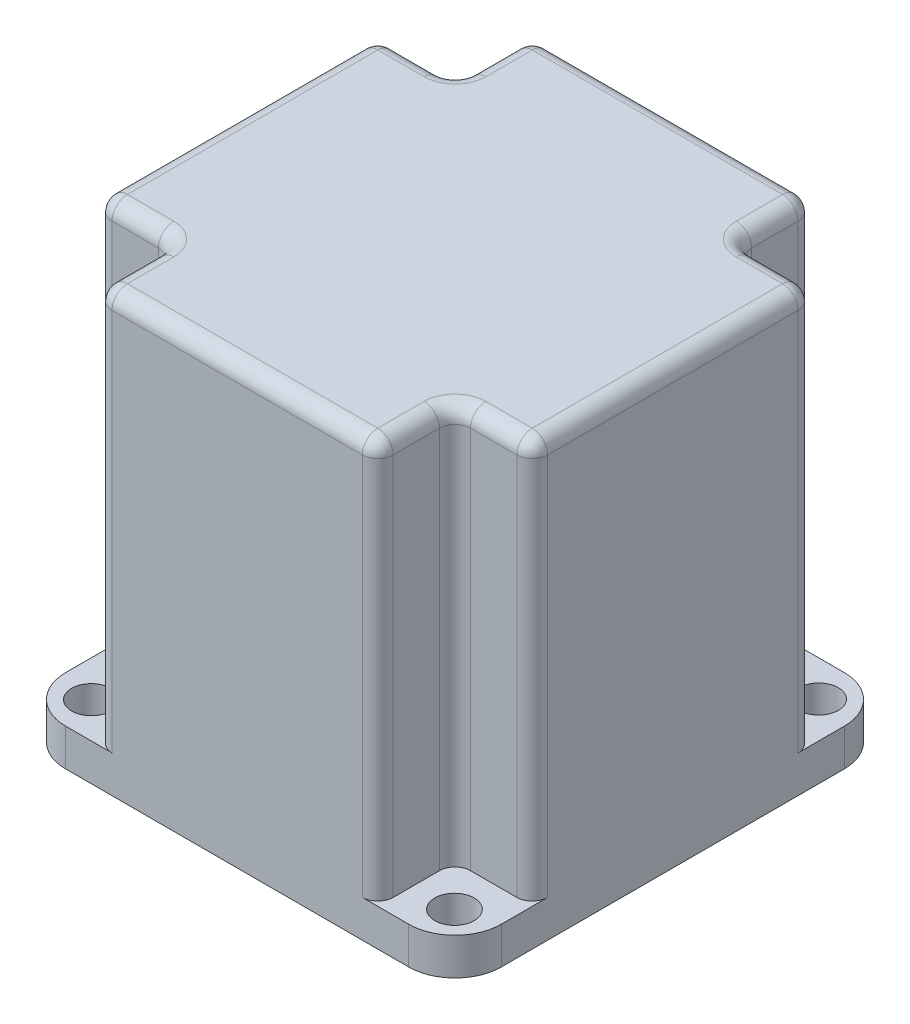
from build123d import *

# Parameters (mm, degrees)
SKETCH_1_R          = 2.55
SKETCH_1_R_2        = 19.05
EXTRUDE_1_DEPTH     = 56.4
SKETCH_1_3_R        = 19.05
SKETCH_1_3_R_2      = 4
EXTRUDE_2_DEPTH     = 1.6
SKETCH_1_4_R        = 2.55
CUT_EXTRUDE_1_DEPTH = 4.8
EXTRUDE_3_DEPTH     = 20.6
SKETCH_4_W          = 10
SKETCH_4_H          = 10
CUT_EXTRUDE_3_DEPTH = 51.6
FILLET_3_R          = 2
FILLET_4_R          = 2


with BuildPart() as part:
    # 草图1 → 凸台-拉伸1 (new body)
    # profile 1 of 10: a face of its own
    with BuildSketch(Plane(origin=(0, 0, 0), x_dir=(1, 0, 0), z_dir=(0, 1, 0))):
        with BuildLine():
            Line((-22.2, 28.2), (22.2, 28.2))
            ThreePointArc((22.2, 28.2), (26.442640687, 26.442640687), (28.2, 22.2))
            Line((28.2, 22.2), (28.2, -22.2))
            ThreePointArc((28.2, -22.2), (26.442640687, -26.442640687), (22.2, -28.2))
            Line((22.2, -28.2), (-22.2, -28.2))
            ThreePointArc((-22.2, -28.2), (-26.442640687, -26.442640687), (-28.2, -22.2))
            Line((-28.2, -22.2), (-28.2, 22.2))
            ThreePointArc((-28.2, 22.2), (-26.442640687, 26.442640687), (-22.2, 28.2))
        make_face()
        with Locations((23.5, 23.57)):
            Circle(SKETCH_1_R, mode=Mode.SUBTRACT)
        with Locations((23.5, -23.57)):
            Circle(SKETCH_1_R, mode=Mode.SUBTRACT)
        Circle(SKETCH_1_R_2, mode=Mode.SUBTRACT)
        with Locations((-23.5, 23.57)):
            Circle(SKETCH_1_R, mode=Mode.SUBTRACT)
        with Locations((-23.5, -23.57)):
            Circle(SKETCH_1_R, mode=Mode.SUBTRACT)
    # profile 2 of 10: a face of its own
    with BuildSketch(Plane(origin=(0, 0, 0), x_dir=(1, 0, 0), z_dir=(0, 1, 0))):
        Circle(SKETCH_1_R_2)
    # profile 3 of 10: a face of its own
    with BuildSketch(Plane(origin=(0, 0, 0), x_dir=(1, 0, 0), z_dir=(0, 1, 0))):
        with Locations((-23.5, 23.57)):
            Circle(SKETCH_1_R)
    # profile 4 of 10: a face of its own
    with BuildSketch(Plane(origin=(0, 0, 0), x_dir=(1, 0, 0), z_dir=(0, 1, 0))):
        with Locations((23.5, 23.57)):
            Circle(SKETCH_1_R)
    # profile 5 of 10: a face of its own
    with BuildSketch(Plane(origin=(0, 0, 0), x_dir=(1, 0, 0), z_dir=(0, 1, 0))):
        with Locations((23.5, -23.57)):
            Circle(SKETCH_1_R)
    # profile 6 of 10: a face of its own
    with BuildSketch(Plane(origin=(0, 0, 0), x_dir=(1, 0, 0), z_dir=(0, 1, 0))):
        with Locations((-23.5, -23.57)):
            Circle(SKETCH_1_R)
    # profile 7 of 10: a face of its own
    with BuildSketch(Plane(origin=(0, 0, 0), x_dir=(1, 0, 0), z_dir=(0, 1, 0))):
        with BuildLine():
            ThreePointArc((2.645751311, 3), (0, 4), (-2.645751311, 3))
            Line((-2.645751311, 3), (2.645751311, 3))
        make_face()
    # profile 8 of 10: a face of its own
    with BuildSketch(Plane(origin=(0, 0, 0), x_dir=(1, 0, 0), z_dir=(0, 1, 0))):
        with BuildLine():
            Line((2.645751311, 3), (-2.645751311, 3))
            ThreePointArc((-2.645751311, 3), (-1.645751311, -3.645751311), (4, 0))
            ThreePointArc((4, 0), (3.645751311, 1.645751311), (2.645751311, 3))
        make_face()
    # profile 9 of 10: a face of its own
    with BuildSketch(Plane(origin=(0, 0, 0), x_dir=(1, 0, 0), z_dir=(0, 1, 0))):
        with BuildLine():
            ThreePointArc((2.645751311, 3), (0, 4), (-2.645751311, 3))
            Line((-2.645751311, 3), (2.645751311, 3))
        make_face()
    # profile 10 of 10: a face of its own
    with BuildSketch(Plane(origin=(0, 0, 0), x_dir=(1, 0, 0), z_dir=(0, 1, 0))):
        with BuildLine():
            Line((2.645751311, 3), (-2.645751311, 3))
            ThreePointArc((-2.645751311, 3), (-1.645751311, -3.645751311), (4, 0))
            ThreePointArc((4, 0), (3.645751311, 1.645751311), (2.645751311, 3))
        make_face()
    extrude(amount=EXTRUDE_1_DEPTH)

    # 草图1<3> → 凸台-拉伸2 (add)
    with BuildSketch(Plane(origin=(0, 0, 0), x_dir=(1, 0, 0), z_dir=(0, 1, 0))):
        with Locations(Location((0, 0, 0), (0, 0, 270))):
            Circle(SKETCH_1_3_R)
        with Locations(Location((0, 0, 0), (0, 0, 270))):
            Circle(SKETCH_1_3_R_2, mode=Mode.SUBTRACT)
    extrude(amount=-EXTRUDE_2_DEPTH)

    # 草图1<4> → 切除-拉伸1 (cut)
    with BuildSketch(Plane(origin=(0, 0, 0), x_dir=(1, 0, 0), z_dir=(0, 1, 0))):
        with Locations(Location((23.5, -23.57, 0), (0, 0, 270))):
            Circle(SKETCH_1_4_R)
        with Locations(Location((-23.5, 23.57, 0), (0, 0, 270))):
            Circle(SKETCH_1_4_R)
        with Locations(Location((23.5, 23.57, 0), (0, 0, 270))):
            Circle(SKETCH_1_4_R)
        with Locations(Location((-23.5, -23.57, 0), (0, 0, 90))):
            Circle(SKETCH_1_4_R)
    extrude(amount=CUT_EXTRUDE_1_DEPTH, mode=Mode.SUBTRACT)

    # 草图1<5> → 凸台-拉伸3 (add)
    with BuildSketch(Plane(origin=(0, 0, 0), x_dir=(1, 0, 0), z_dir=(0, 1, 0))):
        with BuildLine():
            Line((2.645751311, 3), (-2.645751311, 3))
            ThreePointArc((-2.645751311, 3), (-1.645751311, -3.645751311), (4, 0))
            ThreePointArc((4, 0), (3.645751311, 1.645751311), (2.645751311, 3))
        make_face()
    extrude(amount=-EXTRUDE_3_DEPTH)

    # 草图4 → 切除-拉伸3 (cut)
    with BuildSketch(Plane(origin=(0, 56.4, 0), x_dir=(1, 0, 0), z_dir=(0, 1, 0))):
        with Locations((-23.2, 23.2)):
            Rectangle(SKETCH_4_W, SKETCH_4_H)
        with Locations((-23.2, -23.2)):
            Rectangle(SKETCH_4_W, SKETCH_4_H)
        with Locations((23.2, -23.2)):
            Rectangle(SKETCH_4_W, SKETCH_4_H)
        with Locations((23.2, 23.2)):
            Rectangle(SKETCH_4_W, SKETCH_4_H)
    extrude(amount=-CUT_EXTRUDE_3_DEPTH, mode=Mode.SUBTRACT)

    # 圆角3
    fillet_3_edges = [part.edges().sort_by_distance(p)[0] for p in [
        (-23.2, 56.4, -18.2),
        (-18.2, 56.4, -23.2),
        (-28.2, 30.6, -18.2),
        (-18.2, 30.6, -28.2),
        (-18.2, 30.6, -18.2),
        (28.2, 30.6, -18.2),
        (18.2, 30.6, -18.2),
        (18.2, 30.6, -28.2),
        (18.2, 56.4, -23.2),
        (23.2, 56.4, -18.2),
        (23.2, 56.4, 18.2),
        (18.2, 56.4, 23.2),
        (28.2, 30.6, 18.2),
        (18.2, 30.6, 28.2),
        (18.2, 30.6, 18.2),
        (-18.2, 56.4, 23.2),
        (-23.2, 56.4, 18.2),
        (-18.2, 30.6, 28.2),
        (-28.2, 30.6, 18.2),
        (-18.2, 30.6, 18.2),
    ]]
    fillet(fillet_3_edges, radius=FILLET_3_R)

    # 圆角4
    # the kernel refuses this fillet: 2 mm, written as the material it takes off along each edge
    with BuildSketch(Plane(origin=(26.2, 54.4, 16.2), x_dir=(0, 1, 0), z_dir=(1, 0, 0))) as fillet_4_piece_1_section:
        Polygon((0, 0), (FILLET_4_R, 0), (FILLET_4_R, FILLET_4_R), (0, FILLET_4_R), align=None)
    fillet_4_piece_1 = extrude(amount=FILLET_4_R, mode=Mode.PRIVATE)
    fillet_4_piece_1 = fillet_4_piece_1 - Plane(origin=(26.2, 54.4, 16.2), x_dir=(0, -0.7071067811865475, -0.7071067811865475), z_dir=(1, 0, 0)) * Sphere(FILLET_4_R, mode=Mode.PRIVATE)
    add(fillet_4_piece_1, mode=Mode.SUBTRACT)
    with BuildSketch(Plane(origin=(16.2, 54.4, 26.2), x_dir=(0, 1, 0), z_dir=(0, 0, 1))) as fillet_4_piece_2_section:
        Polygon((0, 0), (FILLET_4_R, 0), (FILLET_4_R, -FILLET_4_R), (0, -FILLET_4_R), align=None)
    fillet_4_piece_2 = extrude(amount=FILLET_4_R, mode=Mode.PRIVATE)
    fillet_4_piece_2 = fillet_4_piece_2 - Plane(origin=(16.2, 54.4, 26.2), x_dir=(-0.7071067811865475, -0.7071067811865475, 1.0048591735576168e-15), z_dir=(0, 0, 1)) * Sphere(FILLET_4_R, mode=Mode.PRIVATE)
    add(fillet_4_piece_2, mode=Mode.SUBTRACT)
    with BuildSketch(Plane(origin=(-26.2, 54.4, 16.2), x_dir=(0, 1, 0), z_dir=(-1, 0, 0))) as fillet_4_piece_3_section:
        Polygon((0, 0), (FILLET_4_R, 0), (FILLET_4_R, -FILLET_4_R), (0, -FILLET_4_R), align=None)
    fillet_4_piece_3 = extrude(amount=FILLET_4_R, mode=Mode.PRIVATE)
    fillet_4_piece_3 = fillet_4_piece_3 - Plane(origin=(-26.2, 54.4, 16.2), x_dir=(0, -0.7071067811865475, -0.7071067811865475), z_dir=(-1, 0, 0)) * Sphere(FILLET_4_R, mode=Mode.PRIVATE)
    add(fillet_4_piece_3, mode=Mode.SUBTRACT)
    with BuildSketch(Plane(origin=(-16.2, 54.4, 26.2), x_dir=(0, 1, 0), z_dir=(0, 0, 1))) as fillet_4_piece_4_section:
        Polygon((0, 0), (FILLET_4_R, 0), (FILLET_4_R, FILLET_4_R), (0, FILLET_4_R), align=None)
    fillet_4_piece_4 = extrude(amount=FILLET_4_R, mode=Mode.PRIVATE)
    fillet_4_piece_4 = fillet_4_piece_4 - Plane(origin=(-16.2, 54.4, 26.2), x_dir=(0.7071067811865475, -0.7071067811865475, 0), z_dir=(0, 0, 1)) * Sphere(FILLET_4_R, mode=Mode.PRIVATE)
    add(fillet_4_piece_4, mode=Mode.SUBTRACT)
    with BuildSketch(Plane(origin=(-16.2, 54.4, -26.2), x_dir=(0, 1, 0), z_dir=(0, 0, -1))) as fillet_4_piece_5_section:
        Polygon((0, 0), (FILLET_4_R, 0), (FILLET_4_R, -FILLET_4_R), (0, -FILLET_4_R), align=None)
    fillet_4_piece_5 = extrude(amount=FILLET_4_R, mode=Mode.PRIVATE)
    fillet_4_piece_5 = fillet_4_piece_5 - Plane(origin=(-16.2, 54.4, -26.2), x_dir=(0.7071067811865475, -0.7071067811865475, 0), z_dir=(0, 0, -1)) * Sphere(FILLET_4_R, mode=Mode.PRIVATE)
    add(fillet_4_piece_5, mode=Mode.SUBTRACT)
    with BuildSketch(Plane(origin=(-26.2, 54.4, -16.2), x_dir=(0, 1, 0), z_dir=(-1, 0, 0))) as fillet_4_piece_6_section:
        Polygon((0, 0), (FILLET_4_R, 0), (FILLET_4_R, FILLET_4_R), (0, FILLET_4_R), align=None)
    fillet_4_piece_6 = extrude(amount=FILLET_4_R, mode=Mode.PRIVATE)
    fillet_4_piece_6 = fillet_4_piece_6 - Plane(origin=(-26.2, 54.4, -16.2), x_dir=(0, -0.7071067811865475, 0.7071067811865475), z_dir=(-1, 0, 0)) * Sphere(FILLET_4_R, mode=Mode.PRIVATE)
    add(fillet_4_piece_6, mode=Mode.SUBTRACT)
    with BuildSketch(Plane(origin=(26.2, 54.4, -16.2), x_dir=(0, 1, 0), z_dir=(1, 0, 0))) as fillet_4_piece_7_section:
        Polygon((0, 0), (FILLET_4_R, 0), (FILLET_4_R, -FILLET_4_R), (0, -FILLET_4_R), align=None)
    fillet_4_piece_7 = extrude(amount=FILLET_4_R, mode=Mode.PRIVATE)
    fillet_4_piece_7 = fillet_4_piece_7 - Plane(origin=(26.2, 54.4, -16.2), x_dir=(0, -0.7071067811865475, 0.7071067811865475), z_dir=(1, 0, 0)) * Sphere(FILLET_4_R, mode=Mode.PRIVATE)
    add(fillet_4_piece_7, mode=Mode.SUBTRACT)
    with BuildSketch(Plane(origin=(16.2, 54.4, -26.2), x_dir=(0, 1, 0), z_dir=(0, 0, -1))) as fillet_4_piece_8_section:
        Polygon((0, 0), (FILLET_4_R, 0), (FILLET_4_R, FILLET_4_R), (0, FILLET_4_R), align=None)
    fillet_4_piece_8 = extrude(amount=FILLET_4_R, mode=Mode.PRIVATE)
    fillet_4_piece_8 = fillet_4_piece_8 - Plane(origin=(16.2, 54.4, -26.2), x_dir=(-0.7071067811865475, -0.7071067811865475, -1.0048591735576168e-15), z_dir=(0, 0, -1)) * Sphere(FILLET_4_R, mode=Mode.PRIVATE)
    add(fillet_4_piece_8, mode=Mode.SUBTRACT)
    with BuildSketch(Plane(origin=(-16.2, 56.4, -28.2), x_dir=(0, -1, 0), z_dir=(1, 0, 0)), Plane(origin=(-28.2, 56.4, 16.2), x_dir=(0, -1, 0), z_dir=(0, 0, -1)), Plane(origin=(16.2, 56.4, 28.2), x_dir=(0, -1, 0), z_dir=(-1, 0, 0)), Plane(origin=(28.2, 56.4, -16.2), x_dir=(0, -1, 0), z_dir=(0, 0, 1))) as fillet_4_piece_9:
        with BuildLine():
            CenterArc((FILLET_4_R, -FILLET_4_R), FILLET_4_R, 90, 90)
            Line((0, -FILLET_4_R), (0, 0))
            Line((0, 0), (FILLET_4_R, 0))
        make_face()
    extrude(amount=32.4, mode=Mode.SUBTRACT)


solid = part.part
